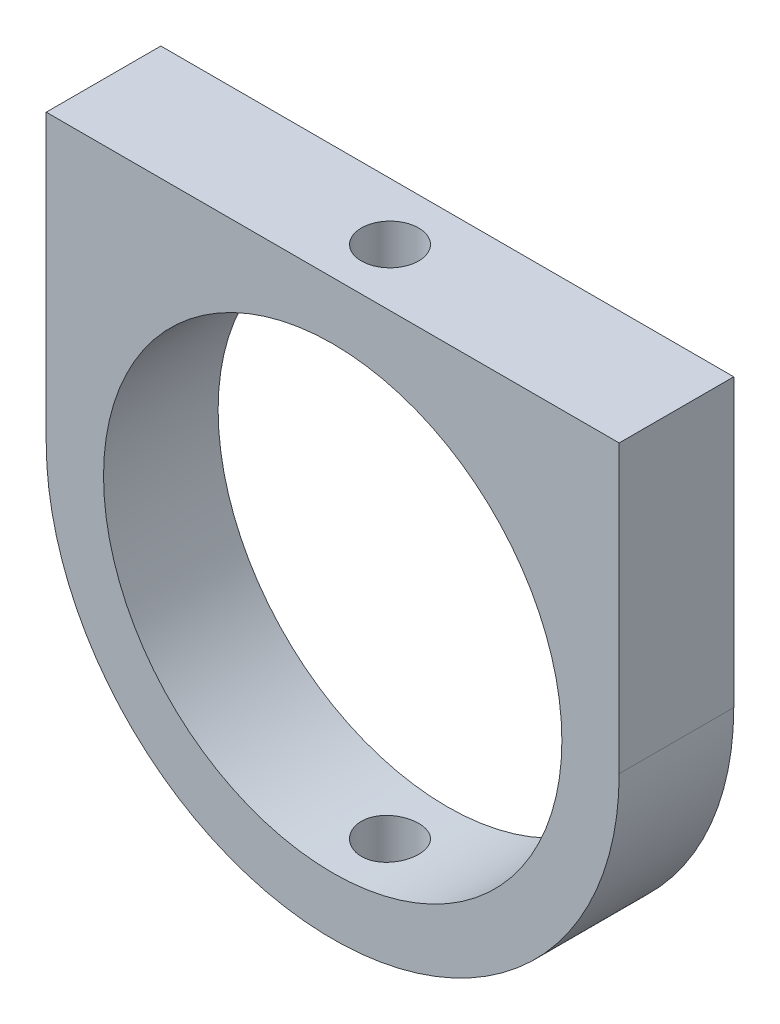
from build123d import *

# Parameters (mm, degrees)
SKETCH1_R           = 8
BOSS_EXTRUDE1_DEPTH = 4
SKETCH3_R           = 1
CUT_EXTRUDE1_DEPTH  = 20


with BuildPart() as part:
    # Sketch1 → Boss-Extrude1 (new body)
    with BuildSketch(Plane.XY):
        with BuildLine():
            ThreePointArc((-10, 0), (-7.071067812, -7.071067812), (0, -10))
            ThreePointArc((0, -10), (7.071067812, -7.071067812), (10, 0))
            Line((10, 0), (10, 10))
            Line((10, 10), (-10, 10))
            Line((-10, 10), (-10, 0))
        make_face()
        Circle(SKETCH1_R, mode=Mode.SUBTRACT)
    extrude(amount=BOSS_EXTRUDE1_DEPTH)

    # Sketch3 → Cut-Extrude1 (cut)
    with BuildSketch(Plane(origin=(0, 10, 0), x_dir=(1, 0, 0), z_dir=(0, 1, 0))):
        with Locations((0, -2)):
            Circle(SKETCH3_R)
    extrude(amount=-CUT_EXTRUDE1_DEPTH, mode=Mode.SUBTRACT)


solid = part.part
